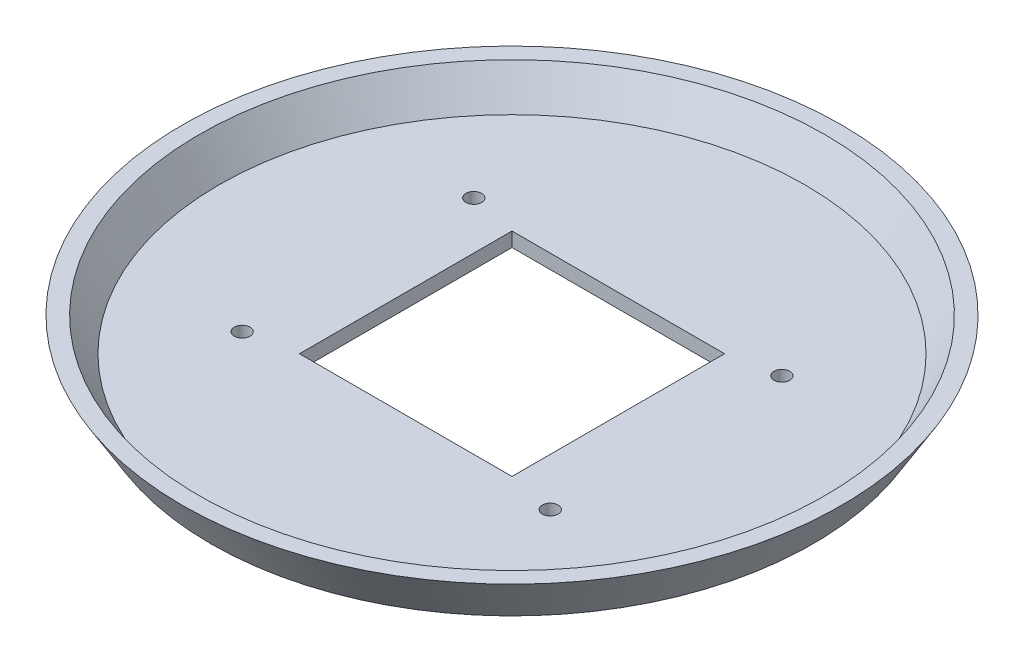
from build123d import *

# Parameters (mm, degrees)
SKETCH2_R          = 1.65
SKETCH2_W          = 44.5
SKETCH2_H          = 44.5
CUT_EXTRUDE1_DEPTH = 98.831487774


with BuildPart() as part:
    # Sketch1 → Revolve1 (revolve)
    with BuildSketch(Plane.XY):
        Polygon((0, 0), (63, 0), (69, 10), (65.501428863, 10), (61.301428863, 3), (0, 3), align=None)
    revolve(axis=Axis((0, 0, 0), (0, 1, 0)))

    # Sketch2 → Cut-Extrude1 (cut, through all)
    with BuildSketch(Plane(origin=(0, 3, 0), x_dir=(1, 0, 0), z_dir=(0, 1, 0))):
        with Locations((-32.25, 24.25)):
            Circle(SKETCH2_R)
        with Locations((32.25, 24.25)):
            Circle(SKETCH2_R)
        with Locations((-32.25, -24.25)):
            Circle(SKETCH2_R)
        with Locations((32.25, -24.25)):
            Circle(SKETCH2_R)
        Rectangle(SKETCH2_W, SKETCH2_H)
    extrude(amount=-CUT_EXTRUDE1_DEPTH, mode=Mode.SUBTRACT)


solid = part.part
